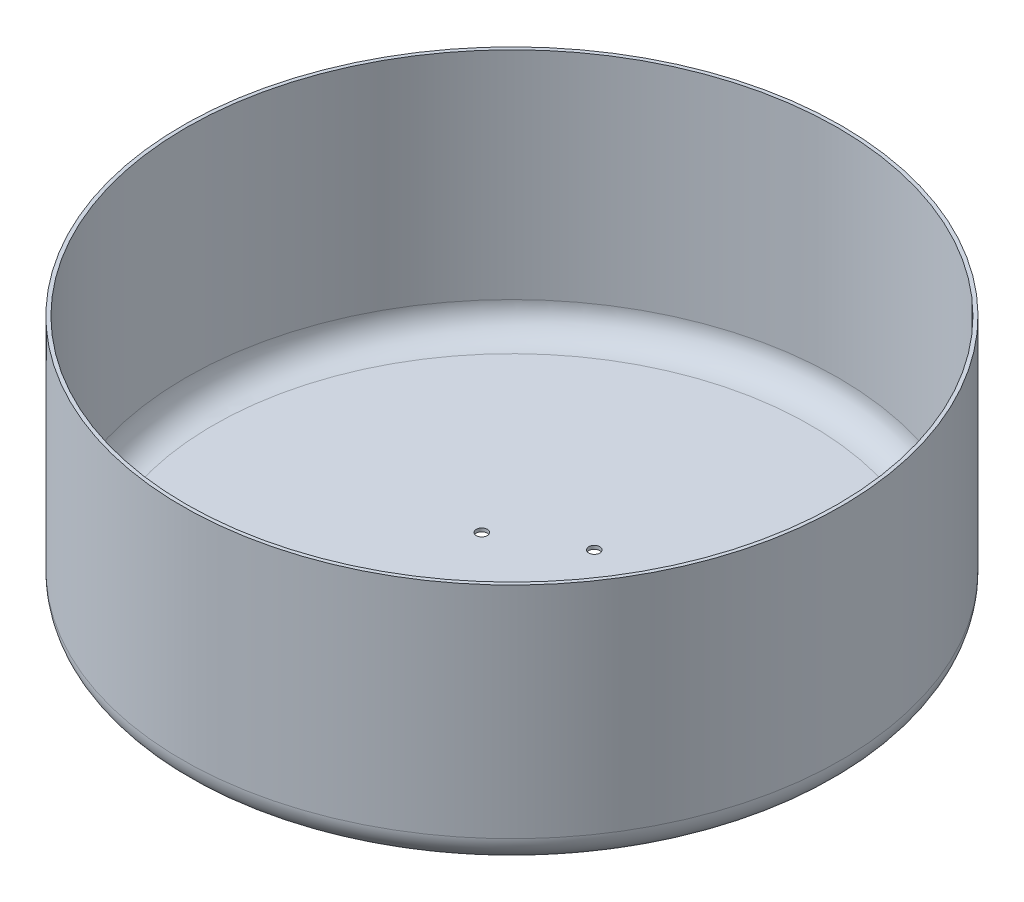
from build123d import *

# Parameters (mm, degrees)
FILLET1_R              = 12.7
F_10_CLEARANCE_HOLE1_D = 5.1054


with BuildPart() as part:
    # Sketch1 → Revolve1 (revolve)
    with BuildSketch(Plane.XY):
        Polygon((0, 0), (152.4, 0), (152.4, 114.3), (150.749, 114.3), (150.749, 1.5748), (0, 1.5748), align=None)
    revolve(axis=Axis((0, 0, 0), (0, 1, 0)))

    # Fillet1
    fillet1_edges = [part.edges().sort_by_distance(p)[0] for p in [
        (-152.4, 0, 0),
        (-150.749, 1.5748, 0),
    ]]
    fillet(fillet1_edges, radius=FILLET1_R)

    # #10 Clearance Hole1 (through all)
    with Locations(Plane.XZ):
        with Locations((0, 38.1), (32.995567884, 19.05), (32.995567884, -19.05), (0, -38.1), (-32.995567884, -19.05), (-32.995567884, 19.05)):
            Hole(F_10_CLEARANCE_HOLE1_D / 2)


solid = part.part
